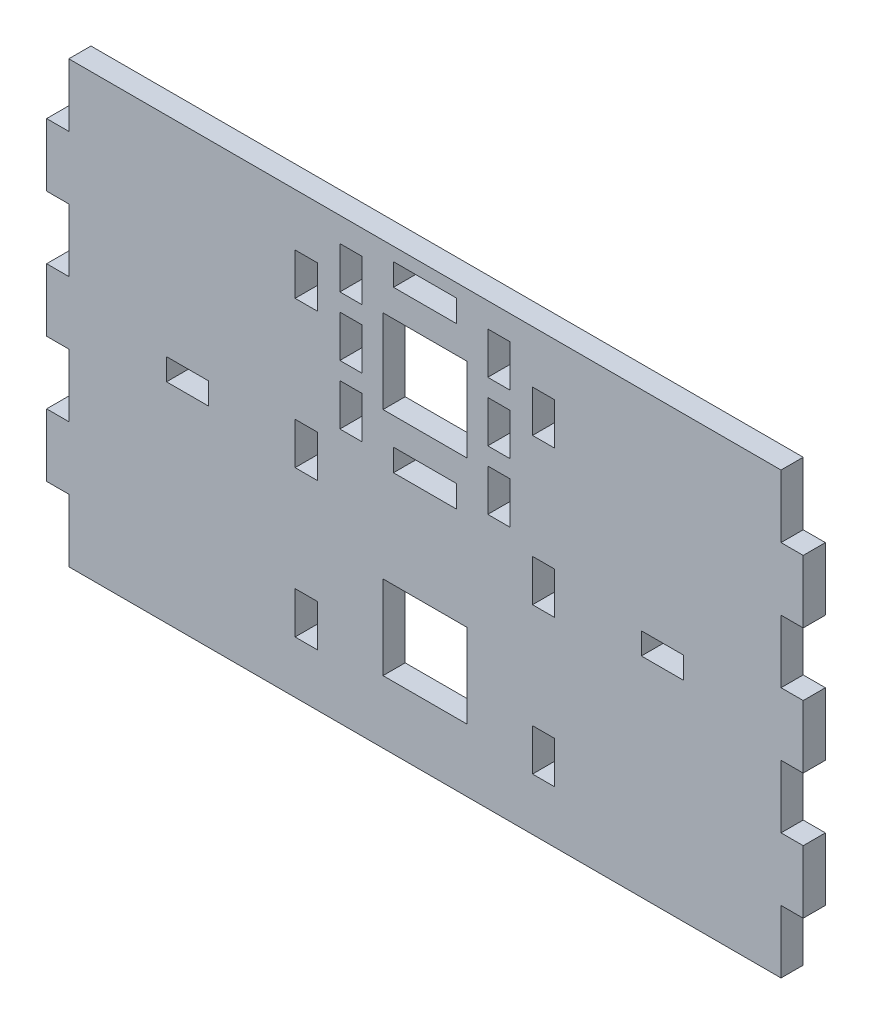
from build123d import *

# Parameters (mm, degrees)
SKETCH1_W           = 12
SKETCH1_H           = 12
SKETCH1_W_2         = 9
SKETCH1_H_2         = 3.175
SKETCH1_W_3         = 3.175
SKETCH1_H_3         = 6
SKETCH1_W_4         = 6
SKETCH1_H_4         = 3.125
BOSS_EXTRUDE1_DEPTH = 1.5875


with BuildPart() as part:
    # Sketch1 → Boss-Extrude1 (new, symmetric)
    with BuildSketch(Plane.XY):
        Polygon((54.175, 0), (54.175, 4.5), (51, 4.5), (51, 13.5), (54.175, 13.5), (54.175, 22.5), (51, 22.5), (51, 31.5), (-51, 31.5), (-51, 22.5), (-54.175, 22.5), (-54.175, 13.5), (-51, 13.5), (-51, 4.5), (-54.175, 4.5), (-54.175, -4.5), (-51, -4.5), (-51, -13.5), (-54.175, -13.5), (-54.175, -22.5), (-51, -22.5), (-51, -31.5), (51, -31.5), (51, -22.5), (54.175, -22.5), (54.175, -13.5), (51, -13.5), (51, -4.5), (54.175, -4.5), align=None)
        with Locations((0, -16.5)):
            Rectangle(SKETCH1_W, SKETCH1_H, mode=Mode.SUBTRACT)
        with Locations((0, 5)):
            Rectangle(SKETCH1_W_2, SKETCH1_H_2, mode=Mode.SUBTRACT)
        with Locations((0, 16.5)):
            Rectangle(SKETCH1_W, SKETCH1_H, mode=Mode.SUBTRACT)
        with Locations((0, 28)):
            Rectangle(SKETCH1_W_2, SKETCH1_H_2, mode=Mode.SUBTRACT)
        with Locations((17, -21)):
            Rectangle(SKETCH1_W_3, SKETCH1_H_3, mode=Mode.SUBTRACT)
        with Locations((17, 0)):
            Rectangle(SKETCH1_W_3, SKETCH1_H_3, mode=Mode.SUBTRACT)
        with Locations((10.5875, 8)):
            Rectangle(SKETCH1_W_3, SKETCH1_H_3, mode=Mode.SUBTRACT)
        Polygon((37, 1.5625), (37, 0), (37, -1.5625), (31, -1.5625), (31, 1.5625), align=None, mode=Mode.SUBTRACT)
        with Locations((10.5875, 16.5)):
            Rectangle(SKETCH1_W_3, SKETCH1_H_3, mode=Mode.SUBTRACT)
        with Locations((17, 21)):
            Rectangle(SKETCH1_W_3, SKETCH1_H_3, mode=Mode.SUBTRACT)
        with Locations((10.5875, 25)):
            Rectangle(SKETCH1_W_3, SKETCH1_H_3, mode=Mode.SUBTRACT)
        with Locations((-10.5875, 25)):
            Rectangle(SKETCH1_W_3, SKETCH1_H_3, mode=Mode.SUBTRACT)
        with Locations((-17, -21)):
            Rectangle(SKETCH1_W_3, SKETCH1_H_3, mode=Mode.SUBTRACT)
        with Locations((-34, 0)):
            Rectangle(SKETCH1_W_4, SKETCH1_H_4, mode=Mode.SUBTRACT)
        with Locations((-17, 0)):
            Rectangle(SKETCH1_W_3, SKETCH1_H_3, mode=Mode.SUBTRACT)
        with Locations((-10.5875, 8)):
            Rectangle(SKETCH1_W_3, SKETCH1_H_3, mode=Mode.SUBTRACT)
        with Locations((-17, 21)):
            Rectangle(SKETCH1_W_3, SKETCH1_H_3, mode=Mode.SUBTRACT)
        with Locations((-10.5875, 16.5)):
            Rectangle(SKETCH1_W_3, SKETCH1_H_3, mode=Mode.SUBTRACT)
    extrude(amount=BOSS_EXTRUDE1_DEPTH, both=True)


solid = part.part
